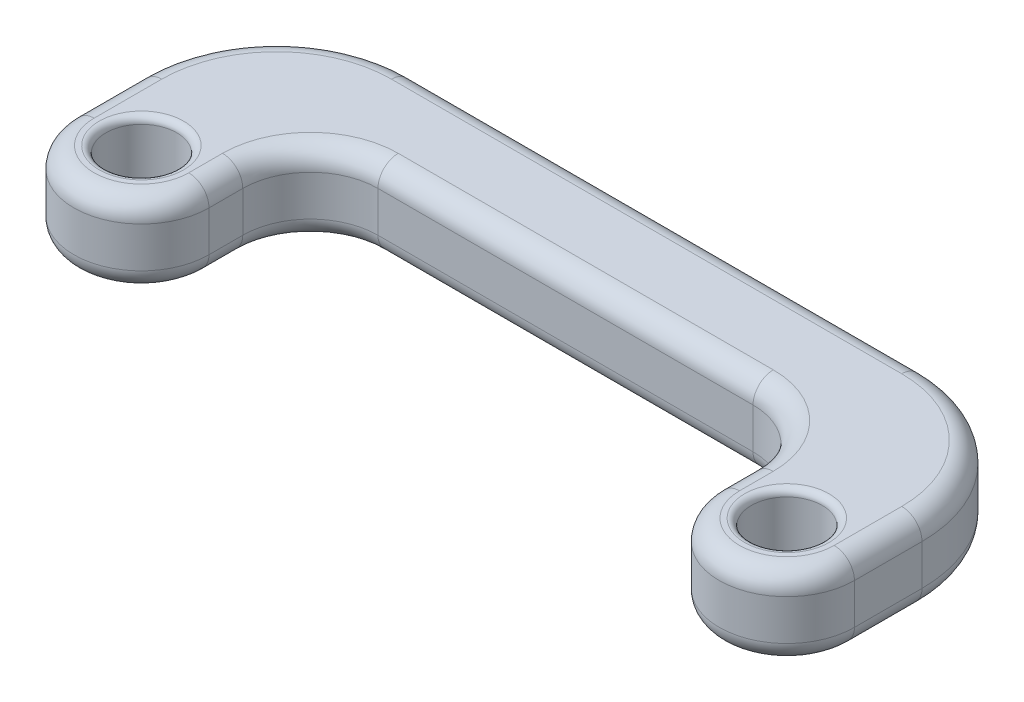
from build123d import *

# Parameters (mm, degrees)
SKETCH7_R           = 5
BOSS_EXTRUDE5_DEPTH = 12
FILLET2_R           = 20
FILLET3_R           = 10
FILLET5_R           = 3
SKETCH11_R          = 5.25
CUT_EXTRUDE1_DEPTH  = 36
FILLET6_R           = 1


with BuildPart() as part:
    # Sketch7 → Boss-Extrude5 (new body)
    with BuildSketch(Plane(origin=(0, 0, 0), x_dir=(1, 0, 0), z_dir=(0, 1, 0))):
        with BuildLine():
            Line((-105.5, 30), (-105.5, 0))
            ThreePointArc((-105.5, 0), (-95.5, -10), (-85.5, 0))
            Line((-85.5, 0), (-85.5, 15))
            Line((-85.5, 15), (-10, 15))
            Line((-10, 15), (-10, 0))
            ThreePointArc((-10, 0), (0, -10), (10, 0))
            Line((10, 0), (10, 30))
            Line((10, 30), (-10, 30))
            Line((-10, 30), (-85.5, 30))
            Line((-85.5, 30), (-105.5, 30))
        make_face()
        with Locations((-95.5, 0)):
            Circle(SKETCH7_R, mode=Mode.SUBTRACT)
    extrude(amount=BOSS_EXTRUDE5_DEPTH)

    # Fillet2
    fillet2_edges = [part.edges().sort_by_distance(p)[0] for p in [
        (10, 6, -30),
        (-105.5, 6, -30),
    ]]
    fillet(fillet2_edges, radius=FILLET2_R)

    # Fillet3
    fillet3_edges = [part.edges().sort_by_distance(p)[0] for p in [
        (-10, 6, -15),
        (-85.5, 6, -15),
    ]]
    fillet(fillet3_edges, radius=FILLET3_R)

    # Fillet5
    fillet5_edges = [part.edges().sort_by_distance(p)[0] for p in [
        (-47.75, 12, -30),
        (4.142135624, 12, -24.142135624),
        (10, 12, -5),
        (0, 12, 10),
        (-10, 12, -2.5),
        (-12.928932188, 12, -12.071067812),
        (-47.75, 12, -15),
        (-82.571067812, 12, -12.071067812),
        (-85.5, 12, -2.5),
        (-95.5, 12, 10),
        (-105.5, 12, -5),
        (-105.5, 0, -5),
        (-95.5, 0, 10),
        (-85.5, 0, -2.5),
        (-82.571067812, 0, -12.071067812),
        (-47.75, 0, -15),
        (-12.928932188, 0, -12.071067812),
        (-10, 0, -2.5),
        (0, 0, 10),
        (10, 0, -5),
        (4.142135624, 0, -24.142135624),
        (-47.75, 0, -30),
        (-99.642135624, 12, -24.142135624),
        (-99.642135624, 0, -24.142135624),
    ]]
    fillet(fillet5_edges, radius=FILLET5_R)

    # Sketch11 → Cut-Extrude1 (cut)
    with BuildSketch(Plane.XZ):
        with Locations((-95.5, 0)):
            Circle(SKETCH11_R)
        Circle(SKETCH11_R)
    extrude(amount=-CUT_EXTRUDE1_DEPTH, mode=Mode.SUBTRACT)

    # Fillet6
    fillet6_edges = [part.edges().sort_by_distance(p)[0] for p in [
        (-100.75, 12, 0),
        (-5.25, 12, 0),
        (-5.25, 0, 0),
        (-100.75, 0, 0),
    ]]
    fillet(fillet6_edges, radius=FILLET6_R)


solid = part.part
